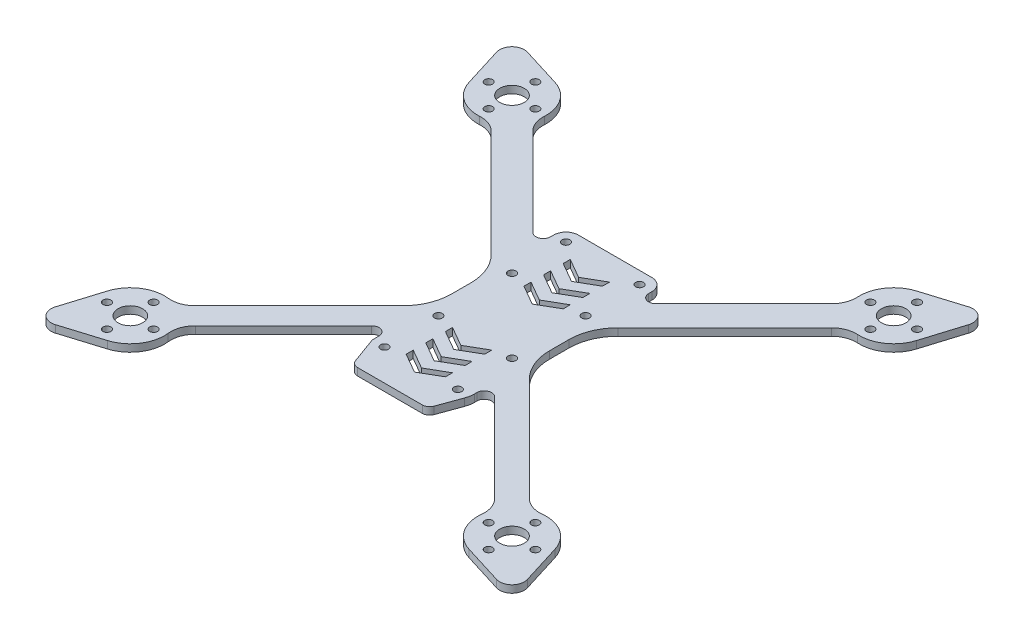
from build123d import *

# Parameters (mm, degrees)
SKETCH1_R           = 1.6
SKETCH1_R_2         = 5
BOSS_EXTRUDE1_DEPTH = 3
CUT_EXTRUDE1_DEPTH  = 137.389779764


with BuildPart() as part:
    # Sketch1 → Boss-Extrude1 (new body)
    with BuildSketch(Plane(origin=(0, 0, 0), x_dir=(1, 0, 0), z_dir=(0, 1, 0))):
        with BuildLine():
            Line((19.341013177, -38.656931626), (16.02192173, -47.77606043))
            ThreePointArc((16.02192173, -47.77606043), (14.923573177, -49.207456133), (13.202843868, -49.75))
            Line((13.202843868, -49.75), (-13.202843868, -49.75))
            ThreePointArc((-13.202843868, -49.75), (-14.923573177, -49.207456133), (-16.02192173, -47.77606043))
            Line((-16.02192173, -47.77606043), (-19.944086969, -37))
            Line((-19.944086969, -37), (-19.944086969, -34.257795468))
            ThreePointArc((-19.944086969, -34.257795468), (-21.796036672, -31.486156871), (-25.065407313, -32.136475125))
            Line((-25.065407313, -32.136475125), (-60.998570725, -68.069638537))
            ThreePointArc((-60.998570725, -68.069638537), (-63.363139484, -71.828794135), (-63.866770837, -76.241139508))
            ThreePointArc((-63.866770837, -76.241139508), (-66.073761636, -85.457884527), (-73.646067483, -91.156952986))
            Line((-73.646067483, -91.156952986), (-89.941777265, -96.195664945))
            ThreePointArc((-89.941777265, -96.195664945), (-94.954339188, -94.954339188), (-96.195664945, -89.941777265))
            Line((-96.195664945, -89.941777265), (-91.156952986, -73.646067483))
            ThreePointArc((-91.156952986, -73.646067483), (-85.457884527, -66.073761636), (-76.241139508, -63.866770837))
            ThreePointArc((-76.241139508, -63.866770837), (-71.828794135, -63.363139484), (-68.069638537, -60.998570725))
            Line((-68.069638537, -60.998570725), (-25.857864376, -18.786796564))
            ThreePointArc((-25.857864376, -18.786796564), (-21.52240935, -12.298329588), (-20, -4.644660941))
            Line((-20, -4.644660941), (-20, 3.230447378))
            ThreePointArc((-20, 3.230447378), (-21.52240935, 10.884116026), (-25.857864376, 17.372583002))
            Line((-25.857864376, 17.372583002), (-69.375275977, 60.889994603))
            ThreePointArc((-69.375275977, 60.889994603), (-72.878122891, 63.16065038), (-77.002761348, 63.803434766))
            ThreePointArc((-77.002761348, 63.803434766), (-85.774590221, 66.287641348), (-91.156952986, 73.646067483))
            Line((-91.156952986, 73.646067483), (-96.195664945, 89.941777265))
            ThreePointArc((-96.195664945, 89.941777265), (-94.954339188, 94.954339188), (-89.941777265, 96.195664945))
            Line((-89.941777265, 96.195664945), (-73.646067483, 91.156952986))
            ThreePointArc((-73.646067483, 91.156952986), (-66.287641348, 85.774590221), (-63.803434766, 77.002761348))
            ThreePointArc((-63.803434766, 77.002761348), (-63.16065038, 72.878122891), (-60.889994603, 69.375275977))
            Line((-60.889994603, 69.375275977), (-25.121320344, 33.606601718))
            ThreePointArc((-25.121320344, 33.606601718), (-21.851949703, 32.956283464), (-20, 35.727922061))
            Line((-20, 35.727922061), (-20, 37))
            ThreePointArc((-20, 37), (-18.535533906, 40.535533906), (-15, 42))
            Line((-15, 42), (15, 42))
            ThreePointArc((15, 42), (18.535533906, 40.535533906), (20, 37))
            Line((20, 37), (20, 35.727922061))
            ThreePointArc((20, 35.727922061), (21.851949703, 32.956283464), (25.121320344, 33.606601718))
            Line((25.121320344, 33.606601718), (60.889994603, 69.375275977))
            ThreePointArc((60.889994603, 69.375275977), (63.16065038, 72.878122891), (63.803434766, 77.002761348))
            ThreePointArc((63.803434766, 77.002761348), (66.287641348, 85.774590221), (73.646067483, 91.156952986))
            Line((73.646067483, 91.156952986), (89.941777265, 96.195664945))
            ThreePointArc((89.941777265, 96.195664945), (94.954339188, 94.954339188), (96.195664945, 89.941777265))
            Line((96.195664945, 89.941777265), (91.156952986, 73.646067483))
            ThreePointArc((91.156952986, 73.646067483), (85.774590221, 66.287641348), (77.002761348, 63.803434766))
            ThreePointArc((77.002761348, 63.803434766), (72.878122891, 63.16065038), (69.375275977, 60.889994603))
            Line((69.375275977, 60.889994603), (25.857864376, 17.372583002))
            ThreePointArc((25.857864376, 17.372583002), (21.52240935, 10.884116026), (20, 3.230447378))
            Line((20, 3.230447378), (20, -4.644660941))
            ThreePointArc((20, -4.644660941), (21.52240935, -12.298329588), (25.857864376, -18.786796564))
            Line((25.857864376, -18.786796564), (68.069638537, -60.998570725))
            ThreePointArc((68.069638537, -60.998570725), (71.828794135, -63.363139484), (76.241139508, -63.866770837))
            ThreePointArc((76.241139508, -63.866770837), (85.457884527, -66.073761636), (91.156952986, -73.646067483))
            Line((91.156952986, -73.646067483), (96.195664945, -89.941777265))
            ThreePointArc((96.195664945, -89.941777265), (94.954339188, -94.954339188), (89.941777265, -96.195664945))
            Line((89.941777265, -96.195664945), (73.646067483, -91.156952986))
            ThreePointArc((73.646067483, -91.156952986), (66.073761636, -85.457884527), (63.866770837, -76.241139508))
            ThreePointArc((63.866770837, -76.241139508), (63.363139484, -71.828794135), (60.998570725, -68.069638537))
            Line((60.998570725, -68.069638537), (25.065407313, -32.136475125))
            ThreePointArc((25.065407313, -32.136475125), (21.796036672, -31.486156871), (19.944086969, -34.257795468))
            Line((19.944086969, -34.257795468), (19.944086969, -35.236730193))
            ThreePointArc((19.944086969, -35.236730193), (19.792164499, -36.97321197), (19.341013177, -38.656931626))
        make_face()
        with Locations((77.781745931, 68.281745931)):
            Circle(SKETCH1_R, mode=Mode.SUBTRACT)
        with Locations((68.281745931, 77.781745931)):
            Circle(SKETCH1_R, mode=Mode.SUBTRACT)
        with Locations((77.781745931, 87.281745931)):
            Circle(SKETCH1_R, mode=Mode.SUBTRACT)
        with Locations((87.281745931, 77.781745931)):
            Circle(SKETCH1_R, mode=Mode.SUBTRACT)
        with Locations((77.781745931, -87.281745931)):
            Circle(SKETCH1_R, mode=Mode.SUBTRACT)
        with Locations((68.281745931, -77.781745931)):
            Circle(SKETCH1_R, mode=Mode.SUBTRACT)
        with Locations((77.781745931, -68.281745931)):
            Circle(SKETCH1_R, mode=Mode.SUBTRACT)
        with Locations((87.281745931, -77.781745931)):
            Circle(SKETCH1_R, mode=Mode.SUBTRACT)
        with Locations((15, 15)):
            Circle(SKETCH1_R, mode=Mode.SUBTRACT)
        with Locations((15, -15)):
            Circle(SKETCH1_R, mode=Mode.SUBTRACT)
        with Locations((77.781745931, 77.781745931)):
            Circle(SKETCH1_R_2, mode=Mode.SUBTRACT)
        with Locations((77.781745931, -77.781745931)):
            Circle(SKETCH1_R_2, mode=Mode.SUBTRACT)
        with Locations((14.944086969, -37)):
            Circle(SKETCH1_R, mode=Mode.SUBTRACT)
        with Locations((15, 37)):
            Circle(SKETCH1_R, mode=Mode.SUBTRACT)
        with Locations((-15, 37)):
            Circle(SKETCH1_R, mode=Mode.SUBTRACT)
        with Locations((-14.944086969, -37)):
            Circle(SKETCH1_R, mode=Mode.SUBTRACT)
        with Locations((-77.781745931, -77.781745931)):
            Circle(SKETCH1_R_2, mode=Mode.SUBTRACT)
        with Locations((-77.781745931, 77.781745931)):
            Circle(SKETCH1_R_2, mode=Mode.SUBTRACT)
        with Locations((-15, -15)):
            Circle(SKETCH1_R, mode=Mode.SUBTRACT)
        with Locations((-15, 15)):
            Circle(SKETCH1_R, mode=Mode.SUBTRACT)
        with Locations((-87.281745931, -77.781745931)):
            Circle(SKETCH1_R, mode=Mode.SUBTRACT)
        with Locations((-77.781745931, -68.281745931)):
            Circle(SKETCH1_R, mode=Mode.SUBTRACT)
        with Locations((-68.281745931, -77.781745931)):
            Circle(SKETCH1_R, mode=Mode.SUBTRACT)
        with Locations((-77.781745931, -87.281745931)):
            Circle(SKETCH1_R, mode=Mode.SUBTRACT)
        with Locations((-87.281745931, 77.781745931)):
            Circle(SKETCH1_R, mode=Mode.SUBTRACT)
        with Locations((-77.781745931, 87.281745931)):
            Circle(SKETCH1_R, mode=Mode.SUBTRACT)
        with Locations((-68.281745931, 77.781745931)):
            Circle(SKETCH1_R, mode=Mode.SUBTRACT)
        with Locations((-77.781745931, 68.281745931)):
            Circle(SKETCH1_R, mode=Mode.SUBTRACT)
    extrude(amount=BOSS_EXTRUDE1_DEPTH)

    # Sketch2 → Cut-Extrude1 (cut, through all)
    with BuildSketch(Plane.XZ):
        Polygon((-8, 35.131197846), (0, 39.75), (8, 35.131197846), (8, 32.244446501), (0, 36.863248654), (-8, 32.244446501), align=None)
        Polygon((-8, 27.131197846), (0, 31.75), (8, 27.131197846), (8, 24.244446501), (0, 28.863248654), (-8, 24.244446501), align=None)
        Polygon((-8, 19.131197846), (0, 23.75), (8, 19.131197846), (8, 16.244446501), (0, 20.863248654), (-8, 16.244446501), align=None)
        Polygon((-8, -12.868802154), (0, -8.25), (8, -12.868802154), (8, -15.755553499), (0, -11.136751346), (-8, -15.755553499), align=None)
        Polygon((-8, -20.868802154), (0, -16.25), (8, -20.868802154), (8, -23.755553499), (0, -19.136751346), (-8, -23.755553499), align=None)
        Polygon((-8, -28.868802154), (0, -24.25), (8, -28.868802154), (8, -31.755553499), (0, -27.136751346), (-8, -31.755553499), align=None)
    extrude(amount=-CUT_EXTRUDE1_DEPTH, mode=Mode.SUBTRACT)


solid = part.part
